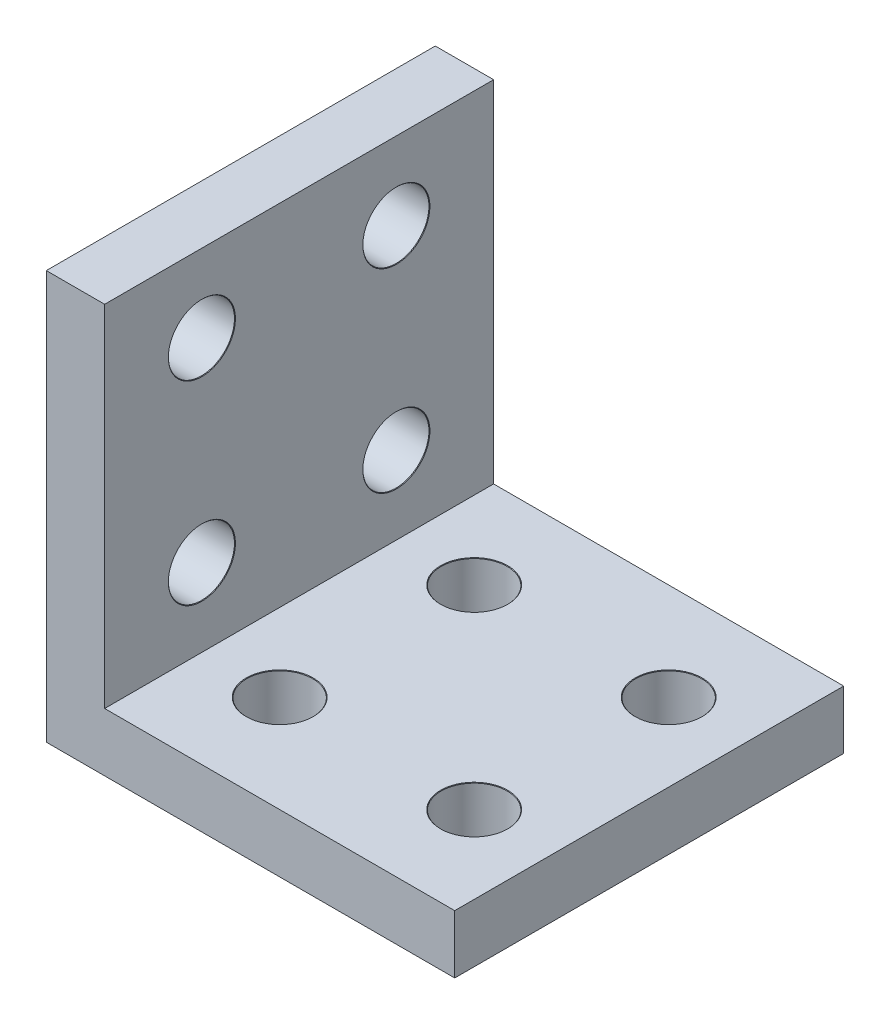
from build123d import *

# Parameters (mm, degrees)
BOSS_EXTRUDE1_DEPTH            = 20
M3_CLEARANCE_HOLE1_D           = 3.4
M3_CLEARANCE_HOLE1_CSINK_D     = 3.45
M3_CLEARANCE_HOLE1_CSINK_ANGLE = 90
M3_CLEARANCE_HOLE2_D           = 3.4
M3_CLEARANCE_HOLE2_CSINK_D     = 3.45
M3_CLEARANCE_HOLE2_CSINK_ANGLE = 90


with BuildPart() as part:
    # Sketch1 → Boss-Extrude1 (new body)
    with BuildSketch(Plane.XY):
        Polygon((0, 21), (0, 0), (21, 0), (21, 3), (3, 3), (3, 21), align=None)
    extrude(amount=BOSS_EXTRUDE1_DEPTH)

    # M3 Clearance Hole1 (through all)
    with Locations(Plane(origin=(0, 3, 0), x_dir=(1, 0, 0), z_dir=(0, 1, 0))):
        with Locations((7, -15), (7, -5), (17, -5), (17, -15)):
            CounterSinkHole(M3_CLEARANCE_HOLE1_D / 2, M3_CLEARANCE_HOLE1_CSINK_D / 2, counter_sink_angle=M3_CLEARANCE_HOLE1_CSINK_ANGLE)

    # M3 Clearance Hole2 (through all)
    with Locations(Plane(origin=(3, 0, 0), x_dir=(0, 0, -1), z_dir=(1, 0, 0))):
        with Locations((-15, 7), (-5, 7), (-5, 17), (-15, 17)):
            CounterSinkHole(M3_CLEARANCE_HOLE2_D / 2, M3_CLEARANCE_HOLE2_CSINK_D / 2, counter_sink_angle=M3_CLEARANCE_HOLE2_CSINK_ANGLE)


solid = part.part
